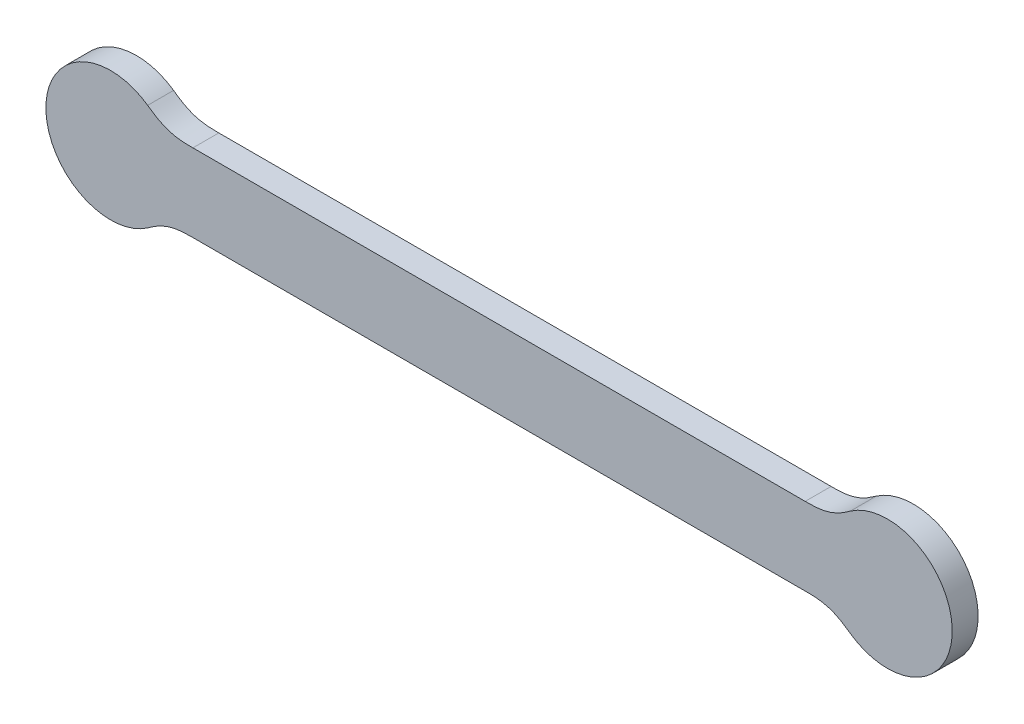
from build123d import *

# Parameters (mm, degrees)
EXTRUDE_1_DEPTH = 20


with BuildPart() as part:
    # 草圖2 → 填料-伸長1 (new body)
    with BuildSketch(Plane.XY):
        with BuildLine():
            Line((63.560994328, -30), (536.439005672, -30))
            add(Edge.make_bspline(
                [(536.439005672, -30), (537.212741722, -29.999991109), (537.613198005, -30.000683506), (538.263961415, -30.001808691), (538.787181951, -30.005366787), (539.408288931, -30.009590548), (539.96075682, -30.017901857), (540.572491868, -30.027104778), (541.133738387, -30.041824727), (542.369232714, -30.074228338), (543.477244925, -30.136822151), (544.687542176, -30.205194249), (545.816503837, -30.313348138), (547.012028881, -30.427878761), (548.150532215, -30.590268573), (549.329521376, -30.75843306), (550.465492407, -30.980586073), (551.620612777, -31.206483974), (552.741330301, -31.490266729), (553.872944852, -31.776808778), (554.976277344, -32.124271471), (556.076158273, -32.470647193), (557.16947177, -32.885220402), (558.240149004, -33.291210174), (559.322231862, -33.769105426), (560.372493269, -34.232946929), (561.437702871, -34.766363764), (562.471049142, -35.283824644), (563.515020076, -35.865211996), (564.52532042, -36.427848198), (565.54126121, -37.048185201), (566.521501071, -37.64672309), (567.519127954, -38.30705168), (567.995303383, -38.622231889), (568.491552142, -38.962385732), (568.946088458, -39.273947771), (569.454656731, -39.63234105), (569.669497199, -39.783741332), (569.933534143, -39.97151526), (570.108839331, -40.096186236), (570.411471222, -40.312164735), (570.753875058, -40.556527173), (570.889409302, -40.652812639), (571.157277374, -40.84310995), (571.368921474, -40.990990991)],
                knots=[0, 0, 0, 0.03125, 0.03125, 0.0625, 0.0625, 0.09375, 0.09375, 0.125, 0.125, 0.1875, 0.1875, 0.25, 0.25, 0.3125, 0.3125, 0.375, 0.375, 0.4375, 0.4375, 0.5, 0.5, 0.5625, 0.5625, 0.625, 0.625, 0.6875, 0.6875, 0.75, 0.75, 0.8125, 0.8125, 0.875, 0.875, 0.90625, 0.90625, 0.9375, 0.9375, 0.953125, 0.953125, 0.96875, 0.96875, 0.984375, 0.984375, 1, 1, 1], degree=2))
            ThreePointArc((571.368921474, -40.990990991), (650, 0), (571.368921474, 40.990990991))
            add(Edge.make_bspline(
                [(571.368921474, 40.990990991), (571.157668377, 40.843383291), (570.889569078, 40.652926094), (570.754355827, 40.556870874), (570.411761719, 40.312372069), (570.109899503, 40.096942355), (569.933956073, 39.971815284), (569.67083739, 39.784691105), (569.455228398, 39.632743933), (568.947751252, 39.275107099), (568.492526507, 38.963053643), (567.997473012, 38.623697851), (567.520687311, 38.308083963), (566.524794707, 37.64884117), (565.544659744, 37.050260588), (564.530952795, 36.431177177), (563.521291511, 35.868705164), (562.479617859, 35.288399386), (561.446132905, 34.770586371), (560.37758625, 34.235206186), (559.321790231, 33.768910382), (558.237223356, 33.289907833), (557.162553819, 32.882597912), (556.068739389, 32.468031894), (554.966418023, 32.121167577), (553.864570085, 31.774452233), (552.732383316, 31.488002164), (551.615062808, 31.205313349), (550.461427812, 30.979791353), (549.330975711, 30.758801339), (548.155206051, 30.590935522), (547.01782843, 30.428550975), (545.820681077, 30.313748517), (544.691849485, 30.205497313), (543.479502617, 30.136949747), (542.371983115, 30.074329247), (541.134801982, 30.041852635), (540.574451401, 30.027143157), (539.961433924, 30.017911943), (539.409931998, 30.009607071), (538.787574486, 30.005369459), (538.265309528, 30.001813374), (537.613376341, 30.000683774), (537.213632873, 29.999991142), (536.439005672, 30)],
                knots=[0, 0, 0, 0.015625, 0.015625, 0.03125, 0.03125, 0.046875, 0.046875, 0.0625, 0.0625, 0.09375, 0.09375, 0.125, 0.125, 0.1875, 0.1875, 0.25, 0.25, 0.3125, 0.3125, 0.375, 0.375, 0.4375, 0.4375, 0.5, 0.5, 0.5625, 0.5625, 0.625, 0.625, 0.6875, 0.6875, 0.75, 0.75, 0.8125, 0.8125, 0.875, 0.875, 0.90625, 0.90625, 0.9375, 0.9375, 0.96875, 0.96875, 1, 1, 1], degree=2))
            Line((536.439005672, 30), (63.560994328, 30))
            add(Edge.make_bspline(
                [(63.560994328, 30), (62.787258277, 29.999991109), (62.386801995, 30.000683506), (61.736038584, 30.001808691), (61.212818049, 30.005366787), (60.591711068, 30.009590548), (60.03924318, 30.017901857), (59.427508131, 30.027104778), (58.866261613, 30.041824727), (57.630767286, 30.074228338), (56.522755075, 30.136822151), (55.312457823, 30.205194249), (54.183496163, 30.313348138), (52.987971119, 30.427878761), (51.849467785, 30.590268573), (50.670478624, 30.75843306), (49.534507593, 30.980586073), (48.379387223, 31.206483974), (47.258669699, 31.490266729), (46.127055147, 31.776808778), (45.023722656, 32.124271471), (43.923841727, 32.470647193), (42.83052823, 32.885220402), (41.759850996, 33.291210174), (40.677768137, 33.769105426), (39.627506729, 34.23294693), (38.562297129, 34.766363764), (37.528950857, 35.283824644), (36.484979924, 35.865211996), (35.474679581, 36.427848197), (34.45873879, 37.048185201), (33.478498928, 37.646723091), (32.480872046, 38.30705168), (32.004696614, 38.62223189), (31.508447858, 38.962385732), (31.053911541, 39.273947772), (30.545343269, 39.63234105), (30.330502803, 39.78374133), (30.066465857, 39.97151526), (29.891160671, 40.096186235), (29.588528778, 40.312164735), (29.246124939, 40.556527175), (29.110590698, 40.652812639), (28.842722624, 40.843109951), (28.631078526, 40.990990991)],
                knots=[0, 0, 0, 0.03125, 0.03125, 0.0625, 0.0625, 0.09375, 0.09375, 0.125, 0.125, 0.1875, 0.1875, 0.25, 0.25, 0.3125, 0.3125, 0.375, 0.375, 0.4375, 0.4375, 0.5, 0.5, 0.5625, 0.5625, 0.625, 0.625, 0.6875, 0.6875, 0.75, 0.75, 0.8125, 0.8125, 0.875, 0.875, 0.90625, 0.90625, 0.9375, 0.9375, 0.953125, 0.953125, 0.96875, 0.96875, 0.984375, 0.984375, 1, 1, 1], degree=2))
            ThreePointArc((28.631078526, 40.990990991), (-50, 0), (28.631078526, -40.990990991))
            add(Edge.make_bspline(
                [(28.631078526, -40.990990991), (28.842331624, -40.843383291), (29.110430922, -40.652926094), (29.245644181, -40.556870869), (29.588238282, -40.312372069), (29.890100487, -40.096942362), (30.066043927, -39.971815284), (30.329162609, -39.784691106), (30.544771602, -39.632743933), (31.052248746, -39.2751071), (31.507473493, -38.963053643), (32.002526989, -38.62369785), (32.479312689, -38.308083963), (33.475205297, -37.648841168), (34.455340256, -37.050260588), (35.469047206, -36.431177177), (36.478708489, -35.868705164), (37.520382139, -35.288399387), (38.553867095, -34.770586371), (39.62241375, -34.235206186), (40.678209769, -33.768910382), (41.762776645, -33.289907833), (42.837446181, -32.882597912), (43.931260611, -32.468031894), (45.033581977, -32.121167577), (46.135429915, -31.774452233), (47.267616684, -31.488002164), (48.384937192, -31.205313349), (49.538572188, -30.979791353), (50.669024289, -30.758801339), (51.844793949, -30.590935522), (52.98217157, -30.428550975), (54.179318923, -30.313748517), (55.308150515, -30.205497313), (56.520497383, -30.136949747), (57.628016885, -30.074329247), (58.865198018, -30.041852635), (59.425548599, -30.027143157), (60.038566076, -30.017911943), (60.590068002, -30.009607071), (61.212425514, -30.005369459), (61.734690473, -30.001813374), (62.386623659, -30.000683774), (62.786367129, -29.999991142), (63.560994328, -30)],
                knots=[0, 0, 0, 0.015625, 0.015625, 0.03125, 0.03125, 0.046875, 0.046875, 0.0625, 0.0625, 0.09375, 0.09375, 0.125, 0.125, 0.1875, 0.1875, 0.25, 0.25, 0.3125, 0.3125, 0.375, 0.375, 0.4375, 0.4375, 0.5, 0.5, 0.5625, 0.5625, 0.625, 0.625, 0.6875, 0.6875, 0.75, 0.75, 0.8125, 0.8125, 0.875, 0.875, 0.90625, 0.90625, 0.9375, 0.9375, 0.96875, 0.96875, 1, 1, 1], degree=2))
        make_face()
    extrude(amount=EXTRUDE_1_DEPTH)


solid = part.part
